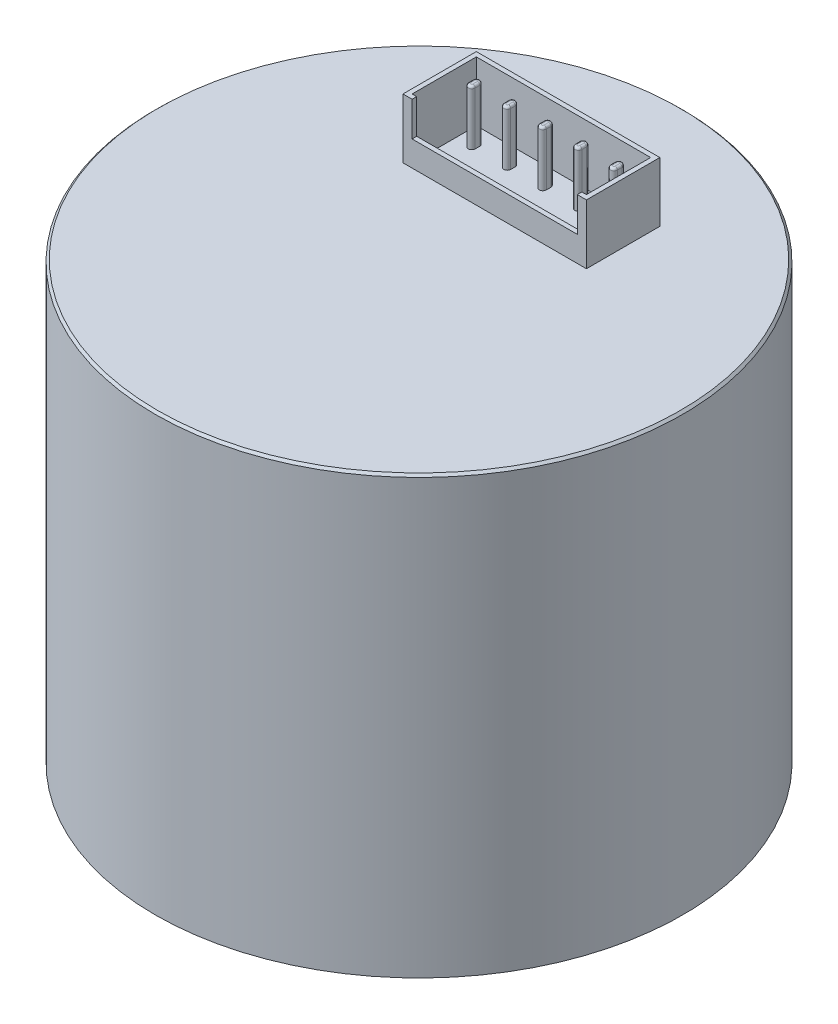
from build123d import *

# Parameters (mm, degrees)
ZAAWANSOWANYOTW_R1_START       = 2
ZAAWANSOWANYOTW_R1_DEPTH       = 3
ZAAWANSOWANYOTW_R1_2_OUTLINE_R = 1.1
ZAAWANSOWANYOTW_R1_2_DEPTH     = 2
SZKIC6_W                       = 8
SZKIC6_H                       = 3.2
SZKIC6_W_2                     = 7.6
SZKIC6_H_2                     = 2.8
DODANIE_WYCI_GNI_CIE1_DEPTH    = 2.6
WYTNIJ_WYCI_GNI_CIE1_REACH     = 30.598
SZKIC7_W                       = 7.2
SZKIC7_H                       = 1.5
DODANIE_WYCI_GNI_CIE2_DEPTH    = 2.4
ZAOKR_GLENIE1_R                = 0.1


# Read off the part's stored shape, not the designer's step: ZaawansowanyOtwór1
with BuildPart() as part:
    # Szkic1 → Obrót1 (revolve)
    with BuildSketch(Plane(origin=(0, 0, 0), x_dir=(0, 0, -1), z_dir=(1, 0, 0))):
        Polygon((0, 19), (-11.4, 19), (-11.5, 18.9), (-11.5, 0), (-6.2, 0), (-6.2, 2), (-9.5, 2), (-9.5, 13), (0, 13), align=None)
    revolve(axis=Axis((0, 22.266164505, 0), (0, -1, 0)))

    # ZaawansowanyOtwór1 outline → ZaawansowanyOtwór1 (cut)
    with BuildSketch(Plane(origin=(0, 0, 0), x_dir=(1, 0, 0), z_dir=(0, 1, 0)).offset(ZAAWANSOWANYOTW_R1_START)):
        with BuildLine():
            ThreePointArc((6.592725397, 6.840027181), (5.45, 9.439676901), (2.627274603, 9.129481265))
            ThreePointArc((2.627274603, 9.129481265), (4.75, 8.227241336), (6.592725397, 6.840027181))
        make_face()
        with BuildLine():
            ThreePointArc((-6.592725397, -6.840027181), (-5.45, -9.439676901), (-2.627274603, -9.129481265))
            ThreePointArc((-2.627274603, -9.129481265), (-4.75, -8.227241336), (-6.592725397, -6.840027181))
        make_face()
    extrude(amount=ZAAWANSOWANYOTW_R1_DEPTH, mode=Mode.SUBTRACT)

    # ZaawansowanyOtw_r1 2 outline → ZaawansowanyOtw_r1 2 (cut)
    with BuildSketch(Plane(origin=(0, 0, 0), x_dir=(1, 0, 0), z_dir=(0, 1, 0))):
        with Locations((4.25, 7.361215932)):
            Circle(ZAAWANSOWANYOTW_R1_2_OUTLINE_R)
        with Locations((-4.25, -7.361215932)):
            Circle(ZAAWANSOWANYOTW_R1_2_OUTLINE_R)
    extrude(amount=ZAAWANSOWANYOTW_R1_2_DEPTH, mode=Mode.SUBTRACT)

    # Szkic6 → Dodanie-wyciągnięcie1 (add)
    with BuildSketch(Plane(origin=(0, 19, 0), x_dir=(1, 0, 0), z_dir=(0, 1, 0))):
        with Locations((0, 4.9)):
            Rectangle(SZKIC6_W, SZKIC6_H)
        with Locations((0, 4.9)):
            Rectangle(SZKIC6_W_2, SZKIC6_H_2, mode=Mode.SUBTRACT)
    extrude(amount=DODANIE_WYCI_GNI_CIE1_DEPTH)

    # Szkic7 → Wytnij-wyciągnięcie1 (cut, up to next)
    with BuildSketch(Plane.XY.offset(-3.3), mode=Mode.PRIVATE) as wytnij_wyci_gni_cie1_sk1:
        with Locations((0, 20.85)):
            Rectangle(SZKIC7_W, SZKIC7_H)
    wytnij_wyci_gni_cie1_tool1 = extrude(wytnij_wyci_gni_cie1_sk1.sketch, amount=-WYTNIJ_WYCI_GNI_CIE1_REACH, mode=Mode.PRIVATE) & part.part
    add(wytnij_wyci_gni_cie1_tool1.solids().sort_by_distance((0, 20.85, -3.3))[0], mode=Mode.SUBTRACT)

    # Szkic8 → Dodanie-wyciągnięcie2 (add)
    with BuildSketch(Plane(origin=(0, 19, 0), x_dir=(1, 0, 0), z_dir=(0, 1, 0))):
        with BuildLine():
            Line((-2.95, 5.6), (-2.95, 5.4))
            ThreePointArc((-2.95, 5.4), (-3.1, 5.25), (-3.25, 5.4))
            Line((-3.25, 5.4), (-3.25, 5.6))
            ThreePointArc((-3.25, 5.6), (-3.1, 5.75), (-2.95, 5.6))
        make_face()
        with BuildLine():
            Line((-1.4, 5.6), (-1.4, 5.4))
            ThreePointArc((-1.4, 5.4), (-1.55, 5.25), (-1.7, 5.4))
            Line((-1.7, 5.4), (-1.7, 5.6))
            ThreePointArc((-1.7, 5.6), (-1.55, 5.75), (-1.4, 5.6))
        make_face()
        with BuildLine():
            Line((0.15, 5.6), (0.15, 5.4))
            ThreePointArc((0.15, 5.4), (0, 5.25), (-0.15, 5.4))
            Line((-0.15, 5.4), (-0.15, 5.6))
            ThreePointArc((-0.15, 5.6), (0, 5.75), (0.15, 5.6))
        make_face()
        with BuildLine():
            Line((1.7, 5.6), (1.7, 5.4))
            ThreePointArc((1.7, 5.4), (1.55, 5.25), (1.4, 5.4))
            Line((1.4, 5.4), (1.4, 5.6))
            ThreePointArc((1.4, 5.6), (1.55, 5.75), (1.7, 5.6))
        make_face()
        with BuildLine():
            Line((3.25, 5.6), (3.25, 5.4))
            ThreePointArc((3.25, 5.4), (3.1, 5.25), (2.95, 5.4))
            Line((2.95, 5.4), (2.95, 5.6))
            ThreePointArc((2.95, 5.6), (3.1, 5.75), (3.25, 5.6))
        make_face()
    extrude(amount=DODANIE_WYCI_GNI_CIE2_DEPTH)

    # Zaokrąglenie1
    zaokr_glenie1_edges = [part.edges().sort_by_distance(p)[0] for p in [
        (-1.55, 21.4, -5.75),
        (-1.7, 21.4, -5.5),
        (-1.55, 21.4, -5.25),
        (-1.4, 21.4, -5.5),
        (0, 21.4, -5.75),
        (-0.15, 21.4, -5.5),
        (0, 21.4, -5.25),
        (0.15, 21.4, -5.5),
        (1.55, 21.4, -5.75),
        (1.4, 21.4, -5.5),
        (1.55, 21.4, -5.25),
        (1.7, 21.4, -5.5),
        (3.1, 21.4, -5.75),
        (2.95, 21.4, -5.5),
        (3.1, 21.4, -5.25),
        (3.25, 21.4, -5.5),
        (-3.1, 21.4, -5.75),
        (-3.25, 21.4, -5.5),
        (-3.1, 21.4, -5.25),
        (-2.95, 21.4, -5.5),
    ]]
    fillet(zaokr_glenie1_edges, radius=ZAOKR_GLENIE1_R)


solid = part.part
